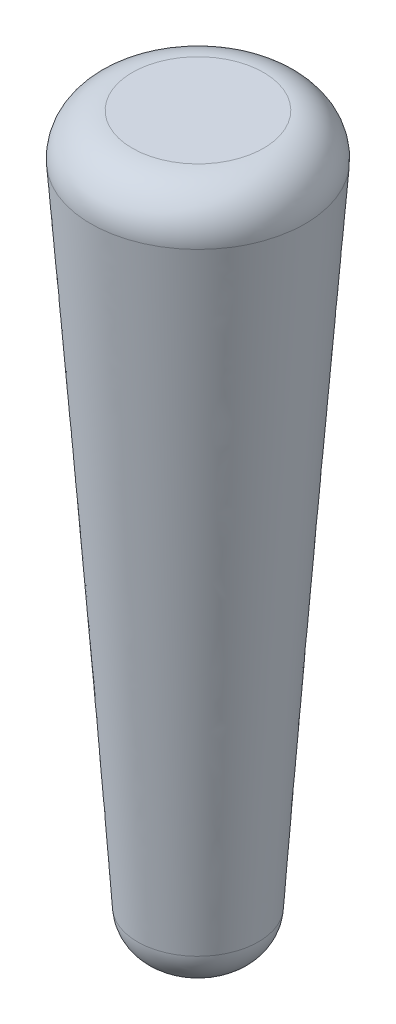
from build123d import *

# Parameters (mm, degrees)
FILLET3_R = 25.4


with BuildPart() as part:
    # Loft1: read off the stored shape, not the designer's step
    # Loft1: loft between two sections, ruled curve by curve
    loft1_from = [
        Edge.make_bspline([(-66.019078693, 0, -14.06169437), (-37.895689953, 0, -146.099851756), (94.142467433, 0, -117.976463016), (66.019078693, 0, 14.06169437), (37.895689953, 0, 146.099851756), (-94.142467433, 0, 117.976463016), (-66.019078693, 0, -14.06169437)], [0, 0, 0, 0, 0.5, 0.5, 0.5, 1, 1, 1, 1], 3, [1, 0.333333333, 0.333333333, 1, 0.333333333, 0.333333333, 1]),
    ]
    loft1_to = [
        Edge.make_bspline([(-30.506950465, -445.008, -17.938424955), (5.369899445, -445.008, -78.952325886), (66.383800376, -445.008, -43.075475975), (30.506950465, -445.008, 17.938424955), (-5.369899445, -445.008, 78.952325886), (-66.383800376, -445.008, 43.075475975), (-30.506950465, -445.008, -17.938424955)], [0, 0, 0, 0, 0.5, 0.5, 0.5, 1, 1, 1, 1], 3, [1, 0.333333333, 0.333333333, 1, 0.333333333, 0.333333333, 1]),
    ]
    loft1 = Solid(Shell([*[Face.make_surface_from_curves(loft1_from[k], loft1_to[k]) for k in range(1)], Face(Wire(loft1_from)), Face(Wire(loft1_to))]))
    add(loft1)

    # Fillet3
    fillet3_edges = [part.edges().sort_by_distance(p)[0] for p in [
        (30.506950465, -445.008, 17.938424955),
        (66.019078693, 0, 14.06169437),
    ]]
    fillet(fillet3_edges, radius=FILLET3_R)


solid = part.part
